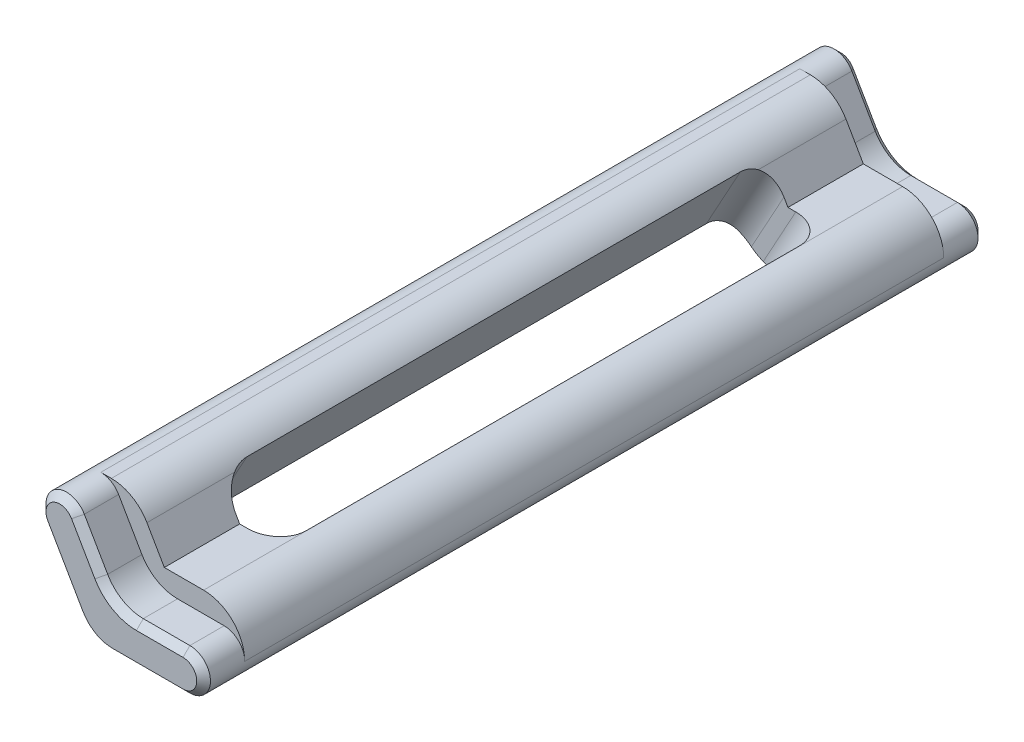
from build123d import *

# Parameters (mm, degrees)
EXTRUDE_1_DEPTH     = 3
EXTRUDE_2_DEPTH     = 51
EXTRUDE_3_DEPTH     = 3
FILLET_1_R          = 3
CHAMFER_1_SIZE      = 0.5
SKETCH_4_W          = 5
SKETCH_4_H          = 40
CUT_EXTRUDE_1_DEPTH = 58.742047602
FILLET_2_R          = 2


with BuildPart() as part:
    # 草图1 → 凸台-拉伸1 (new body)
    with BuildSketch(Plane.XY):
        with BuildLine():
            Line((-4.299038106, 4.446152423), (-0.866025404, -1.5))
            Line((-0.866025404, -1.5), (6, -1.5))
            ThreePointArc((6, -1.5), (7.5, 0), (6, 1.5))
            Line((6, 1.5), (0.866025404, 1.5))
            Line((0.866025404, 1.5), (-1.700961894, 5.946152423))
            ThreePointArc((-1.700961894, 5.946152423), (-3.75, 6.495190528), (-4.299038106, 4.446152423))
        make_face()
    extrude(amount=EXTRUDE_1_DEPTH)

    # 草图2 → 凸台-拉伸2 (add)
    with BuildSketch(Plane.XY.offset(3)):
        with BuildLine():
            Line((-0.5, 6.696152423), (-3, 6.696152423))
            ThreePointArc((-3, 6.696152423), (-2.25, 6.495190528), (-1.700961894, 5.946152423))
            Line((-1.700961894, 5.946152423), (0.866025404, 1.5))
            Line((0.866025404, 1.5), (6, 1.5))
            ThreePointArc((6, 1.5), (7.060660172, 1.060660172), (7.5, 0))
            Line((7.5, 0), (7.5, 3))
            Line((7.5, 3), (1.633974596, 3))
            Line((1.633974596, 3), (-0.5, 6.696152423))
        make_face()
        with BuildLine():
            Line((-4.299038106, 4.446152423), (-0.866025404, -1.5))
            Line((-0.866025404, -1.5), (6, -1.5))
            ThreePointArc((6, -1.5), (7.060660172, -1.060660172), (7.5, 0))
            ThreePointArc((7.5, 0), (7.060660172, 1.060660172), (6, 1.5))
            Line((6, 1.5), (0.866025404, 1.5))
            Line((0.866025404, 1.5), (-1.700961894, 5.946152423))
            ThreePointArc((-1.700961894, 5.946152423), (-1.551111261, 5.58438099), (-1.5, 5.196152423))
            ThreePointArc((-1.5, 5.196152423), (-2.611771432, 3.747263683), (-4.299038106, 4.446152423))
        make_face()
        with BuildLine():
            ThreePointArc((-3, 6.696152423), (-4.299038106, 5.946152423), (-4.299038106, 4.446152423))
            ThreePointArc((-4.299038106, 4.446152423), (-2.611771432, 3.747263683), (-1.5, 5.196152423))
            ThreePointArc((-1.5, 5.196152423), (-1.551111261, 5.58438099), (-1.700961894, 5.946152423))
            ThreePointArc((-1.700961894, 5.946152423), (-2.25, 6.495190528), (-3, 6.696152423))
        make_face()
    extrude(amount=EXTRUDE_2_DEPTH)

    # 草图3 → 凸台-拉伸3 (add)
    with BuildSketch(Plane.XY.offset(54)):
        with BuildLine():
            Line((-4.299038106, 4.446152423), (-0.866025404, -1.5))
            Line((-0.866025404, -1.5), (6, -1.5))
            ThreePointArc((6, -1.5), (7.5, 0), (6, 1.5))
            Line((6, 1.5), (0.866025404, 1.5))
            Line((0.866025404, 1.5), (-1.700961894, 5.946152423))
            ThreePointArc((-1.700961894, 5.946152423), (-3.75, 6.495190528), (-4.299038106, 4.446152423))
        make_face()
    extrude(amount=EXTRUDE_3_DEPTH)

    # 圆角1
    fillet_1_edges = [part.edges().sort_by_distance(p)[0] for p in [
        (0.866025404, 1.5, 55.5),
        (7.5, 3, 28.5),
        (-0.5, 6.696152423, 28.5),
        (0.866025404, 1.5, 1.5),
        (-0.866025404, -1.5, 28.5),
    ]]
    fillet(fillet_1_edges, radius=FILLET_1_R - 0.0001)  # a hair under: the kernel refuses the full size

    # 倒角1
    chamfer_1_edges = [part.edges().sort_by_distance(p)[0] for p in [
        (7.5, 0, 57),
        (-3.75, 6.495190528, 57),
        (-3.015530023, 2.223051211, 57),
        (-0.850466513, 4.473051211, 57),
        (4.299009238, 1.5, 57),
        (-3.75, 6.495190528, 0),
        (-0.850466513, 4.473051211, 0),
        (4.299009238, 1.5, 0),
        (3.432983834, -1.5, 0),
        (3.432983834, -1.5, 57),
        (-3.015530023, 2.223051211, 0),
        (-0.633982331, -1.098089609, 0),
        (-0.633982331, -1.098089609, 57),
        (1.098068476, 1.901910391, 57),
        (1.098068476, 1.901910391, 0),
        (7.5, 0, 0),
    ]]
    chamfer(chamfer_1_edges, length=CHAMFER_1_SIZE)

    # 草图4 → 切除-拉伸1 (cut, through all)
    with BuildSketch(Plane(origin=(2.486112979, 4.528124648, 0), x_dir=(0.8765717103484919, -0.4812712713394804, 0), z_dir=(0.4812712713394804, 0.8765717103484919, 0))):
        with Locations((-0.011517908, -28.5)):
            Rectangle(SKETCH_4_W, SKETCH_4_H)
    extrude(amount=-CUT_EXTRUDE_1_DEPTH, mode=Mode.SUBTRACT)

    # 圆角2
    fillet_2_edges = [part.edges().sort_by_distance(p)[0] for p in [
        (-1.076934244, 3.257015136, 48.5),
        (3.250658802, 0.75, 48.5),
        (-1.076934244, 3.257015136, 8.5),
        (3.250658802, 0.75, 8.5),
    ]]
    fillet(fillet_2_edges, radius=FILLET_2_R)


solid = part.part
